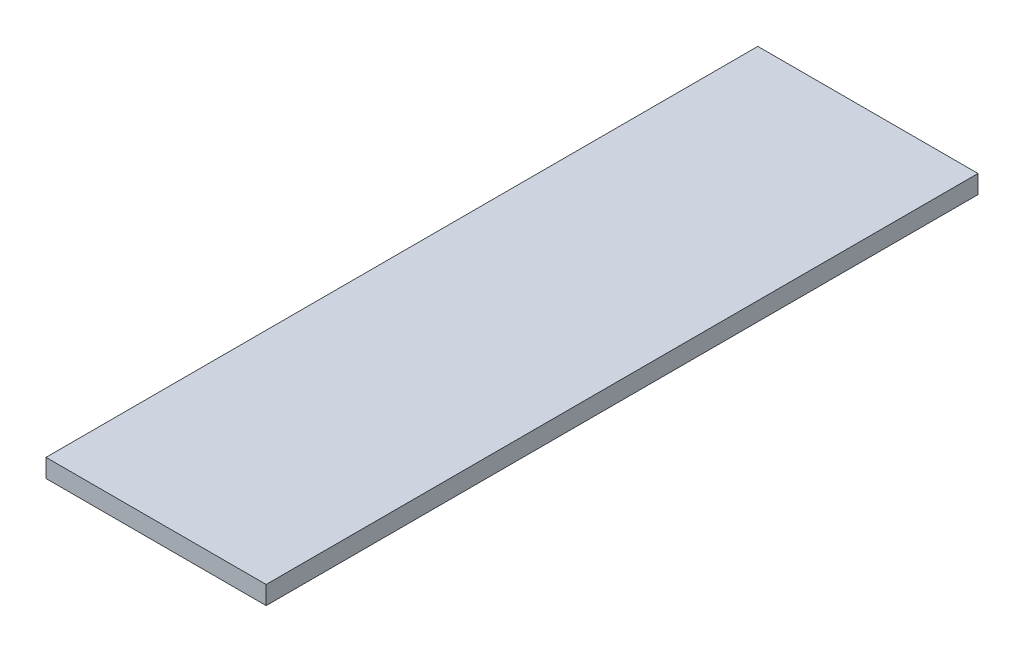
from build123d import *

# Parameters (mm, degrees)
SKETCH1_W           = 60
SKETCH1_H           = 194
BOSS_EXTRUDE1_DEPTH = 5


with BuildPart() as part:
    # Sketch1 → Boss-Extrude1 (new body)
    with BuildSketch(Plane(origin=(0, 0, 0), x_dir=(1, 0, 0), z_dir=(0, 1, 0))):
        with Locations((30, -97)):
            Rectangle(SKETCH1_W, SKETCH1_H)
    extrude(amount=BOSS_EXTRUDE1_DEPTH)


solid = part.part
